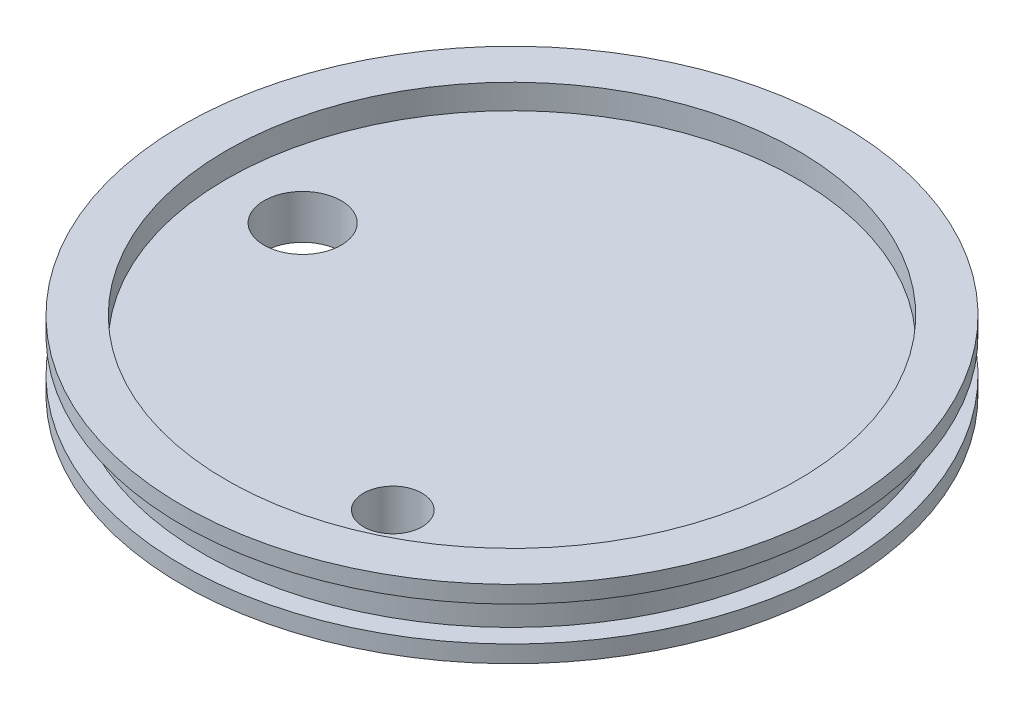
from build123d import *

# Parameters (mm, degrees)
PIPE_TAP_DRILL_FOR_1_4_TAP1_D = 11.1252
PIPE_TAP_DRILL_FOR_1_8_TAP1_D = 8.4328


with BuildPart() as part:
    # Sketch1 → Revolve1 (revolve)
    with BuildSketch(Plane.XY):
        Polygon((0, 0), (47.498, 0), (47.498, 2.4638), (44.577, 2.4638), (44.577, 7.4422), (47.498, 7.4422), (47.498, 9.906), (41.148, 9.906), (41.148, 6.35), (0, 6.35), align=None)
    revolve(axis=Axis((0, 48.192213231, 0), (0, -1, 0)))

    # Pipe Tap Drill for 1/4 Tap1 (through all)
    with Locations(Plane(origin=(0, 6.35, 0), x_dir=(1, 0, 0), z_dir=(0, 1, 0))):
        with Locations((-30.1752, 0)):
            Hole(PIPE_TAP_DRILL_FOR_1_4_TAP1_D / 2)

    # Pipe Tap Drill for 1/8 Tap1 (through all)
    with Locations(Plane(origin=(0, 6.35, 0), x_dir=(1, 0, 0), z_dir=(0, 1, 0))):
        with Locations((12.150198978, -29.333175157)):
            Hole(PIPE_TAP_DRILL_FOR_1_8_TAP1_D / 2)


solid = part.part
